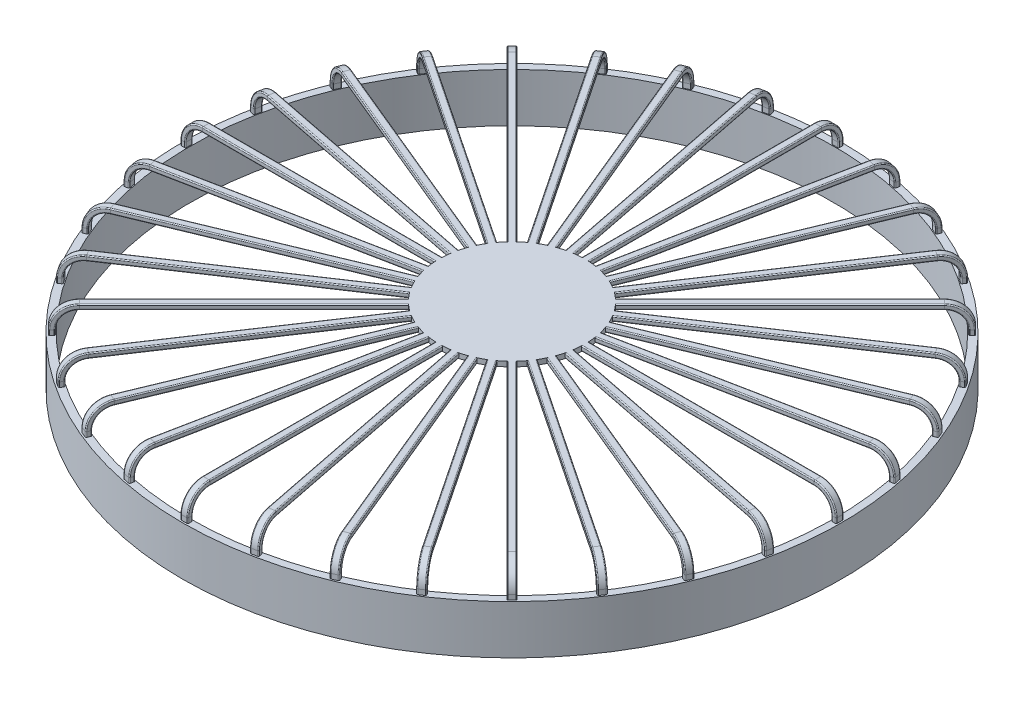
from build123d import *
from build123d.topology import SkipClean

# Parameters (mm, degrees)
SKETCH_1_R               = 67.5
SKETCH_1_R_2             = 66
EXTRUDE_1_DEPTH          = 10
PATTERN_CIRCULAR_1_COUNT = 32
SKETCH_6_R               = 15
EXTRUDE_2_DEPTH          = 1


with BuildPart() as part:
    # 草图1 → 凸台-拉伸1 (new body)
    with BuildSketch(Plane(origin=(0, 0, 0), x_dir=(1, 0, 0), z_dir=(0, 1, 0))):
        Circle(SKETCH_1_R)
        Circle(SKETCH_1_R_2, mode=Mode.SUBTRACT)
    extrude(amount=EXTRUDE_1_DEPTH)

    # 扫描3: sweep along a path in 草图3
    with BuildLine(Plane.XY) as sweep_3_path:
        Line((-66.65, 10), (-66.65, 11))
        ThreePointArc((-66.65, 11), (-65.478427125, 13.828427125), (-62.65, 15))
        Line((-62.65, 15), (0, 15))
    # 草图4 → 扫描3 (sweep)
    with BuildSketch(Plane(origin=(0, 10, 0), x_dir=(1, 0, 0), z_dir=(0, 1, 0))):
        with BuildLine():
            Line((-66.95, 0.75), (-66.35, 0.75))
            ThreePointArc((-66.35, 0.75), (-66.208578644, 0.691421356), (-66.15, 0.55))
            Line((-66.15, 0.55), (-66.15, -0.55))
            ThreePointArc((-66.15, -0.55), (-66.208578644, -0.691421356), (-66.35, -0.75))
            Line((-66.35, -0.75), (-66.95, -0.75))
            ThreePointArc((-66.95, -0.75), (-67.091421356, -0.691421356), (-67.15, -0.55))
            Line((-67.15, -0.55), (-67.15, 0.55))
            ThreePointArc((-67.15, 0.55), (-67.091421356, 0.691421356), (-66.95, 0.75))
        make_face()
    sweep_3 = sweep(path=sweep_3_path.line)

    # 阵列(圆周)1: 扫描3 ×32 about axis
    with SkipClean():  # the faces are left unmerged after this step: merging them gives an invalid solid
        pattern_circular_1_axis = Axis((0, 10, 0), (0, 1, 0))
        for i in range(1, PATTERN_CIRCULAR_1_COUNT):
            add(sweep_3.rotate(pattern_circular_1_axis, i * 360 / PATTERN_CIRCULAR_1_COUNT))

    # 草图6 → 凸台-拉伸2 (add)
    with SkipClean():  # the faces are left unmerged after this step: merging them gives an invalid solid
        with BuildSketch(Plane(origin=(0, 15.5, 0), x_dir=(1, 0, 0), z_dir=(0, 1, 0))):
            Circle(SKETCH_6_R)
        extrude(amount=-EXTRUDE_2_DEPTH)


solid = part.part
